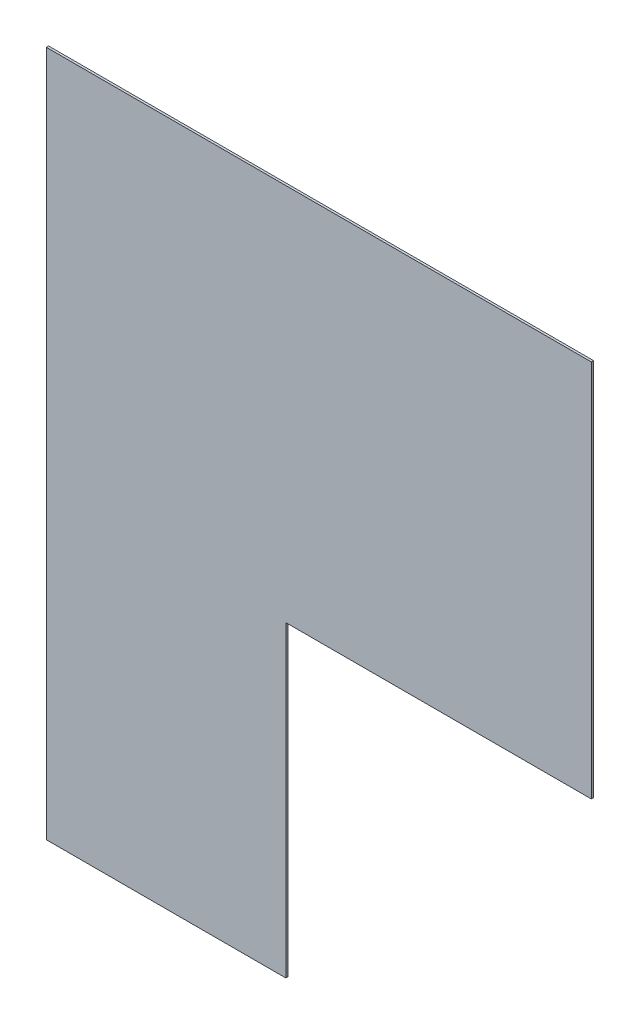
from build123d import *

# Parameters (mm, degrees)
TABAN_FLAN_1_DEPTH         = 5
KES_EKSTR_ZYON1_DEPTH      = 2347.284296499
KES_EKSTR_ZYON1_DEPTH_BACK = 2347.284296499


# Sheet-metal steps are written as plain solids
with BuildPart() as part:
    # Çizim1 → Taban-Flanş1 (new body)
    with BuildSketch(Plane.XY):
        Polygon((0, 0), (1195, 0), (1195, -895), (1800, -895), (1800, -1505), (0, -1505), align=None)
    extrude(amount=-TABAN_FLAN_1_DEPTH)

    # Çizim2 → Kes-Ekstrüzyon1 (cut, two sides: drawn at the far end of the back side and taken through both)
    with BuildSketch(Plane.XY.offset(-KES_EKSTR_ZYON1_DEPTH_BACK)):
        Polygon((525, -1505), (525, -830), (1195, -830), (1965.528313332, -849.744695172), (1943.261334952, -1718.704035599), align=None)
    extrude(amount=KES_EKSTR_ZYON1_DEPTH + KES_EKSTR_ZYON1_DEPTH_BACK, mode=Mode.SUBTRACT)


solid = part.part
